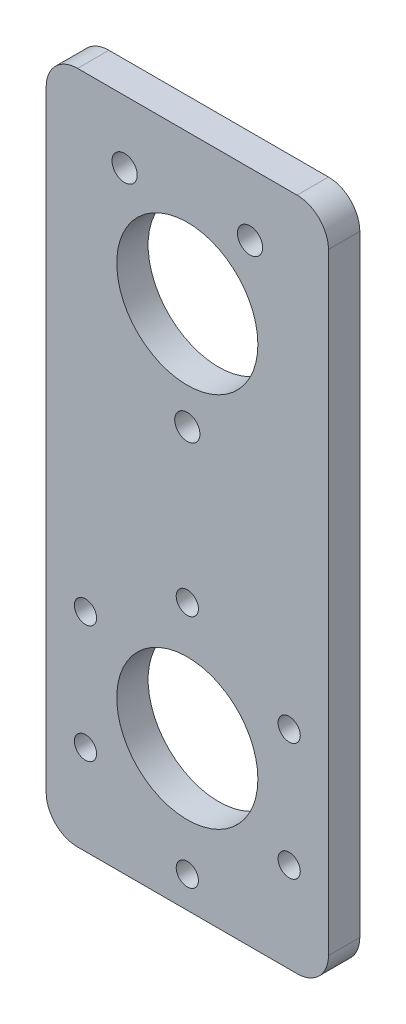
from build123d import *

# Parameters (mm, degrees)
SKETCH1_W              = 57.15
SKETCH1_H              = 136.525
SKETCH1_R              = 14.2875
BOSS_EXTRUDE1_DEPTH    = 3.175
FILLET1_R              = 6.35
F_8_CLEARANCE_HOLE1_D  = 4.4958
F_10_CLEARANCE_HOLE1_D = 5.1054


with BuildPart() as part:
    # Sketch1 → Boss-Extrude1 (new, symmetric)
    with BuildSketch(Plane.XY):
        Rectangle(SKETCH1_W, SKETCH1_H)
        with Locations((0, 38.1)):
            Circle(SKETCH1_R, mode=Mode.SUBTRACT)
        with Locations((0, -38.1)):
            Circle(SKETCH1_R, mode=Mode.SUBTRACT)
    extrude(amount=BOSS_EXTRUDE1_DEPTH, both=True)

    # Fillet1
    fillet1_edges = [part.edges().sort_by_distance(p)[0] for p in [
        (28.575, -68.2625, 0),
        (-28.575, -68.2625, 0),
        (-28.575, 68.2625, 0),
        (28.575, 68.2625, 0),
    ]]
    fillet(fillet1_edges, radius=FILLET1_R)

    # #8 Clearance Hole1 (through all)
    with Locations(Plane.XY.offset(3.175)):
        with Locations((0, -14.2875), (20.622229928, -26.19375), (20.622229928, -50.00625), (0, -61.9125), (-20.622229928, -50.00625), (-20.622229928, -26.19375), (0, -38.1)):
            Hole(F_8_CLEARANCE_HOLE1_D / 2)

    # #10 Clearance Hole1 (through all)
    with Locations(Plane.XY.offset(3.175)):
        with Locations((-12.7, 55.5625), (12.7, 55.5625), (0, 16.51)):
            Hole(F_10_CLEARANCE_HOLE1_D / 2)


solid = part.part
